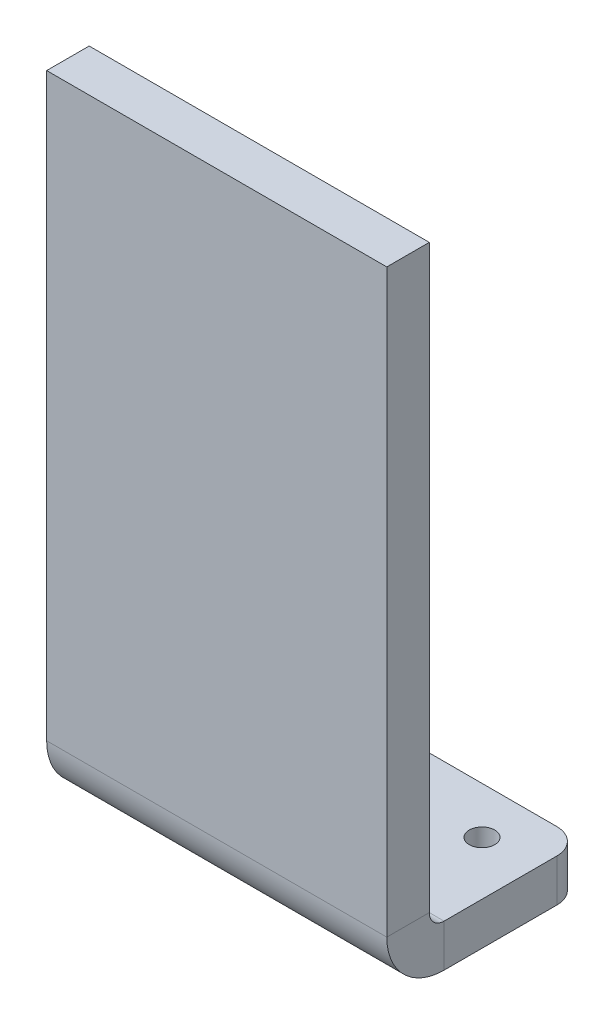
from build123d import *

# Parameters (mm, degrees)
SKETCH_13_W                      = 40
SKETCH_13_H                      = 5
SM_BASE_FLANGE_1_DEPTH           = 18
SM_EDGE_FLANGE_1_STRIP_W         = 23.4732
SM_EDGE_FLANGE_1_STRIP_H         = 5
SM_EDGE_FLANGE_1_STRIP_CUT_DEPTH = 40
SM_EDGE_FLANGE_1_DEPTH           = 40
SKETCH_26_R                      = 1.5
CUT_EXTRUDE_1_DEPTH              = 81.956778592
FILLET_1_R                       = 3
SKETCH_32_R                      = 3.3
CUT_EXTRUDE_4_DEPTH              = 1


# Sheet-metal steps are written as plain solids
with BuildPart() as part:
    # 草图13 → 基体-法兰1 (new body)
    with BuildSketch(Plane.XY):
        with Locations((0, -2.5)):
            Rectangle(SKETCH_13_W, SKETCH_13_H)
    extrude(amount=SM_BASE_FLANGE_1_DEPTH)

    # 边线-法兰1 strip (across the edge) → 边线-法兰1 strip cut (cut)
    with BuildSketch(Plane(origin=(-20, 0, 18), x_dir=(0, 0, -1), z_dir=(1, 0, 0))):
        with Locations((-10, -2.5)):
            Rectangle(SM_EDGE_FLANGE_1_STRIP_W, SM_EDGE_FLANGE_1_STRIP_H)
    extrude(amount=SM_EDGE_FLANGE_1_STRIP_CUT_DEPTH, mode=Mode.SUBTRACT)

    # 边线-法兰1 section (across the edge) → 边线-法兰1 (add)
    with BuildSketch(Plane(origin=(-20, 0, 18), x_dir=(0, 0, -1), z_dir=(1, 0, 0))):
        with BuildLine():
            Line((-5, 1.7366), (-5, 70))
            Line((-5, 70), (0, 70))
            Line((0, 70), (0, 1.7366))
            ThreePointArc((0, 1.7366), (0.508638364, 0.508638364), (1.7366, 0))
            Line((1.7366, 0), (1.7366, -5))
            ThreePointArc((1.7366, -5), (-3.026895542, -3.026895542), (-5, 1.7366))
        make_face()
    extrude(amount=SM_EDGE_FLANGE_1_DEPTH)

    # 草图26 → 切除-拉伸1 (cut, through all)
    with BuildSketch(Plane.XZ.offset(5)):
        with Locations(Location((-13.7, 5.5, 0), (0, 0, 270))):
            Circle(SKETCH_26_R)
        with Locations(Location((13.7, 5.5, 0), (0, 0, 270))):
            Circle(SKETCH_26_R)
    extrude(amount=-CUT_EXTRUDE_1_DEPTH, mode=Mode.SUBTRACT)

    # 圆角1
    fillet_1_edges = [part.edges().sort_by_distance(p)[0] for p in [
        (-20, -2.5, 0),
        (20, -2.5, 0),
    ]]
    fillet(fillet_1_edges, radius=FILLET_1_R)

    # 草图32 → 切除-拉伸4 (cut)
    with BuildSketch(Plane(origin=(0, -5, 0), x_dir=(-1, 0, 0), z_dir=(0, -1, 0))):
        with Locations(Location((13.7, -5.5, 0), (0, 0, 90))):
            Circle(SKETCH_32_R)
        with Locations(Location((-13.7, -5.5, 0), (0, 0, 90))):
            Circle(SKETCH_32_R)
    extrude(amount=-CUT_EXTRUDE_4_DEPTH, mode=Mode.SUBTRACT)


solid = part.part
